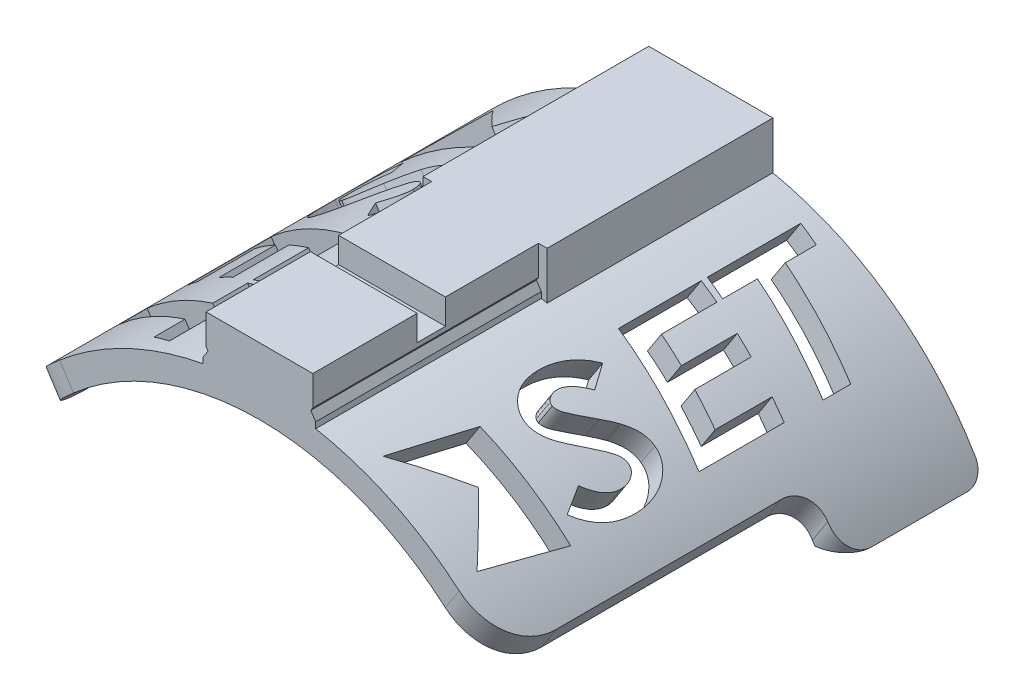
from build123d import *
from build123d.topology import SkipClean

# Parameters (mm, degrees)
BOSS_EXTRU_1_DEPTH           = 145
ENL_V_MAT_EXTRU_5_DEPTH      = 40
ESQUISSE23_W                 = 18.93
ESQUISSE23_H                 = 4.5
ENL_V_MAT_EXTRU_8_DEPTH      = 5
COQUE7_DEPTH                 = 102.5
COQUE7_START                 = 102.5
COQUE7_2_DEPTH               = 16.5
COQUE7_START_2               = 129
COQUE7_3_DEPTH               = 13.5
COQUE7_START_3               = 119
COQUE7_4_DEPTH               = 10
ENL_V_MAT_EXTRU_9_DEPTH      = 40
BOSS_EXTRU_7_DEPTH           = 2
ENL_V_MAT_EXTRU_6_DEPTH      = 10
R_P_TITION_CIRCULAIRE1_COUNT = 2
ENL_V_START                  = -65
ESQUISSE25_W                 = 97.112048686
ESQUISSE25_H                 = 37.05
ENL_V_MAT_EXTRU_10_DEPTH     = 65
ENL_V_MAT_EXTRU_12_DEPTH     = 167.08894215
BOSS_EXTRU_8_DEPTH           = 3
CONG_1_R                     = 3


# Read off the part's stored shape, not the designer's step: Coque7
with BuildPart() as part:
    # Esquisse1 → Boss.-Extru.1 (new body)
    with BuildSketch(Plane.XY):
        with BuildLine():
            Line((11, 61.8), (11, 53.378366404))
            ThreePointArc((11, 53.378366404), (33.039761646, 43.343098071), (48.556024343, 24.75))
            Line((48.556024343, 24.75), (43.444648692, 24.75))
            ThreePointArc((43.444648692, 24.75), (0, 50), (-43.444648692, 24.75))
            Line((-43.444648692, 24.75), (-48.556024343, 24.75))
            ThreePointArc((-48.556024343, 24.75), (-33.039761646, 43.343098071), (-11, 53.378366404))
            Line((-11, 53.378366404), (-11, 61.8))
            Line((-11, 61.8), (11, 61.8))
        make_face()
    extrude(amount=BOSS_EXTRU_1_DEPTH)

    # Esquisse8 → Enlèv. mat.-Extru.5 (cut)
    with BuildSketch(Plane.XY.offset(145)):
        Polygon((9.465, 61.8), (-9.465, 61.8), (-9.465, 56.52), (-9.095982677, 55.960780709), (-9.966432785, 54.642176671), (-9.966432785, 54.142176671), (-11, 54.142176671), (-11, 61.8), (-11, 71.016985955), (11, 71.016985955), (11, 54.142176671), (9.966432785, 54.142176671), (9.966432785, 54.642176671), (9.095982677, 55.960780709), (9.465, 56.52), align=None)
    extrude(amount=-ENL_V_MAT_EXTRU_5_DEPTH, mode=Mode.SUBTRACT)

    # Esquisse23 → Enlèv. mat.-Extru.8 (cut)
    with BuildSketch(Plane.XY.offset(126.5)):
        with Locations((0, 59.55)):
            Rectangle(ESQUISSE23_W, ESQUISSE23_H)
    extrude(amount=-ENL_V_MAT_EXTRU_8_DEPTH, mode=Mode.SUBTRACT)

    # Coque7 outline → Coque7 (cut)
    with BuildSketch(Plane.XY):
        with BuildLine():
            Line((-8.5, 59.3), (-8.5, 51.807335388))
            ThreePointArc((-8.5, 51.807335388), (0, 52.5), (8.5, 51.807335388))
            Line((8.5, 51.807335388), (8.5, 59.3))
            Line((8.5, 59.3), (-8.5, 59.3))
        make_face()
    extrude(amount=COQUE7_DEPTH, mode=Mode.SUBTRACT)

    # Coque7 2 outline → Coque7 2 (cut)
    with BuildSketch(Plane.XY.offset(COQUE7_START)):
        with BuildLine():
            Line((-6.100563013, 55.960519309), (-7.466432785, 53.891427261))
            Line((-7.466432785, 53.891427261), (-7.466432785, 51.96635817))
            ThreePointArc((-7.466432785, 51.96635817), (0, 52.5), (7.466432785, 51.96635817))
            Line((7.466432785, 51.96635817), (7.466432785, 53.891427261))
            Line((7.466432785, 53.891427261), (6.100563013, 55.960519309))
            Line((6.100563013, 55.960519309), (6.965, 57.270511575))
            Line((6.965, 57.270511575), (6.965, 59.3))
            Line((6.965, 59.3), (-6.965, 59.3))
            Line((-6.965, 59.3), (-6.965, 57.270511575))
            Line((-6.965, 57.270511575), (-6.100563013, 55.960519309))
        make_face()
    extrude(amount=COQUE7_2_DEPTH, mode=Mode.SUBTRACT)

    # Coque7 3 outline → Coque7 3 (cut)
    with BuildSketch(Plane.XY.offset(COQUE7_START_2)):
        with BuildLine():
            Line((-6.100563013, 55.960519309), (-7.466432785, 53.891427261))
            Line((-7.466432785, 53.891427261), (-7.466432785, 51.96635817))
            ThreePointArc((-7.466432785, 51.96635817), (0, 52.5), (7.466432785, 51.96635817))
            Line((7.466432785, 51.96635817), (7.466432785, 53.891427261))
            Line((7.466432785, 53.891427261), (6.100563013, 55.960519309))
            Line((6.100563013, 55.960519309), (6.965, 57.270511575))
            Line((6.965, 57.270511575), (6.965, 59.3))
            Line((6.965, 59.3), (-6.965, 59.3))
            Line((-6.965, 59.3), (-6.965, 57.270511575))
            Line((-6.965, 57.270511575), (-6.100563013, 55.960519309))
        make_face()
    extrude(amount=COQUE7_3_DEPTH, mode=Mode.SUBTRACT)

    # Coque7 4 outline → Coque7 4 (cut)
    with BuildSketch(Plane.XY.offset(COQUE7_START_3)):
        with BuildLine():
            Line((6.866656647, 54.8), (-6.866656647, 54.8))
            Line((-6.866656647, 54.8), (-7.466432785, 53.891427261))
            Line((-7.466432785, 53.891427261), (-7.466432785, 51.96635817))
            ThreePointArc((-7.466432785, 51.96635817), (0, 52.5), (7.466432785, 51.96635817))
            Line((7.466432785, 51.96635817), (7.466432785, 53.891427261))
            Line((7.466432785, 53.891427261), (6.866656647, 54.8))
        make_face()
    extrude(amount=COQUE7_4_DEPTH, mode=Mode.SUBTRACT)

    # Esquisse24 → Enlèv. mat.-Extru.9 (cut)
    with BuildSketch(Plane.XY.offset(105)):
        with BuildLine():
            Line((9.966432785, 54.142176671), (11, 54.142176671))
            Line((11, 54.142176671), (11, 53.378366404))
            ThreePointArc((11, 53.378366404), (10.483705827, 53.48216443), (9.966432785, 53.5809688))
            Line((9.966432785, 53.5809688), (9.966432785, 54.142176671))
        make_face()
        with BuildLine():
            Line((-11, 54.142176671), (-9.966432785, 54.142176671))
            Line((-9.966432785, 54.142176671), (-9.966432785, 53.5809688))
            ThreePointArc((-9.966432785, 53.5809688), (-10.483705827, 53.48216443), (-11, 53.378366404))
            Line((-11, 53.378366404), (-11, 54.142176671))
        make_face()
    extrude(amount=ENL_V_MAT_EXTRU_9_DEPTH, mode=Mode.SUBTRACT)

    # Esquisse16 → Boss.-Extru.7 (add)
    with BuildSketch(Plane(origin=(0, 0, 0), x_dir=(-1, 0, 0), z_dir=(0, 0, -1))):
        with BuildLine():
            Line((11, 61.8), (-11, 61.8))
            Line((-11, 61.8), (-11, 53.378366404))
            ThreePointArc((-11, 53.378366404), (-33.039761646, 43.343098071), (-48.556024343, 24.75))
            Line((-48.556024343, 24.75), (-43.444648692, 24.75))
            ThreePointArc((-43.444648692, 24.75), (0, 50), (43.444648692, 24.75))
            Line((43.444648692, 24.75), (48.556024343, 24.75))
            ThreePointArc((48.556024343, 24.75), (33.039761646, 43.343098071), (11, 53.378366404))
            Line((11, 53.378366404), (11, 61.8))
        make_face()
    extrude(amount=-BOSS_EXTRU_7_DEPTH)

    # Esquisse20 → Enlèv. mat.-Extru.6 (cut)
    with BuildSketch(Plane(origin=(29.682827408, 45.707545953, 0), x_dir=(-0.8386705679454272, 0.5446390350150224, 0), z_dir=(0.5446390350150224, 0.8386705679454272, 0))):
        Polygon((9.855900057, 126.817740377), (-9.219044866, 126.817740377), (-6.169102617, 141.093120116), (3.031167376, 133.286236941), (12.905842307, 141.093120116), align=None)
        with BuildLine():
            Line((9.00498024, 105.886575416), (6.43970914, 109.656039892))
            add(Edge.make_bspline(
                [(6.43970914, 109.656039892), (6.638551673, 109.845899276), (7.021246309, 110.211304839), (7.536051252, 110.7772966), (7.977281746, 111.330108329), (8.331845241, 111.880913694), (8.610361527, 112.420213128), (8.813740282, 112.949400132), (8.939914155, 113.470448431), (8.955145191, 113.816366313), (8.962579065, 113.985199882)],
                knots=[0, 0, 0, 0, 1.28138621, 2.466170703, 3.564226601, 4.574985265, 5.515057864, 6.388849122, 7.213638939, 8, 8, 8, 8], degree=3))
            add(Edge.make_bspline(
                [(8.962579065, 113.985199882), (8.957032032, 114.143918987), (8.946347066, 114.449651484), (8.860220843, 114.888596443), (8.718451691, 115.287538697), (8.513331335, 115.632629155), (8.278528567, 115.922180046), (8.009575947, 116.133148299), (7.714826291, 116.267503018), (7.506738439, 116.283692053), (7.402215817, 116.291823813)],
                knots=[0, 0, 0, 0, 1.239941831, 2.388436538, 3.482545333, 4.532407983, 5.512815959, 6.379186426, 7.185864615, 8, 8, 8, 8], degree=3))
            add(Edge.make_bspline(
                [(7.402215817, 116.291823813), (7.299709013, 116.283198178), (7.082389511, 116.264911404), (6.751417799, 116.147556803), (6.412791907, 115.948382795), (6.110762245, 115.730278333), (5.844515275, 115.477954004), (5.575197102, 115.216970287), (5.261886633, 114.870204676), (4.885675458, 114.453391374), (4.455062769, 113.959364121), (3.972674808, 113.383693637), (3.42913994, 112.737945283), (3.053986041, 112.277008461), (2.856809834, 112.034745822)],
                knots=[0, 0, 0, 0, 0.580699583, 1.231111871, 1.965688795, 2.801225581, 3.33365008, 4.041043863, 4.924495772, 5.97858417, 7.220802023, 8.634887725, 10.231338997, 12, 12, 12, 12], degree=3))
            add(Edge.make_bspline(
                [(2.856809834, 112.034745822), (2.750917628, 111.906037758), (2.546838003, 111.657986515), (2.252453561, 111.30377996), (1.98136357, 110.985482042), (1.733193951, 110.703489296), (1.509727564, 110.454856161), (1.312106006, 110.238407016), (1.137634875, 110.059346876), (1.028142451, 109.954020365), (0.978437772, 109.906206826)],
                knots=[0, 0, 0, 0, 1.408298228, 2.714127721, 3.891595392, 4.940901426, 5.888051599, 6.716310398, 7.417262163, 8, 8, 8, 8], degree=3))
            add(Edge.make_bspline(
                [(0.978437772, 109.906206826), (0.770294212, 109.714012223), (0.371383588, 109.345668044), (-0.240593748, 108.860764165), (-0.83023469, 108.458605588), (-1.403274733, 108.13758951), (-1.970557226, 107.901567426), (-2.537592082, 107.734202238), (-3.109289881, 107.627949243), (-3.494443798, 107.614661261), (-3.685691501, 107.60806313)],
                knots=[0, 0, 0, 0, 1.274429781, 2.442466046, 3.509623425, 4.483132402, 5.392566679, 6.267918392, 7.139937007, 8, 8, 8, 8], degree=3))
            add(Edge.make_bspline(
                [(-3.685691501, 107.60806313), (-3.896838533, 107.613559428), (-4.313656059, 107.624409468), (-4.923605208, 107.741515455), (-5.508906969, 107.916800712), (-6.065822417, 108.172552044), (-6.598297227, 108.494806957), (-7.101203144, 108.896120925), (-7.582138552, 109.362934422), (-8.026466838, 109.901831677), (-8.438320415, 110.489843579), (-8.789343859, 111.131804421), (-9.091455521, 111.810673826), (-9.337010888, 112.53032156), (-9.52877478, 113.288970868), (-9.661012125, 114.088981328), (-9.750319371, 114.928724469), (-9.757909394, 115.502920252), (-9.761779909, 115.795730063)],
                knots=[0, 0, 0, 0, 0.892117206, 1.761095492, 2.617811278, 3.47135016, 4.345986664, 5.244253171, 6.187096921, 7.17612425, 8.194427065, 9.219377751, 10.265932693, 11.334190361, 12.431889946, 13.572061692, 14.761878478, 16, 16, 16, 16], degree=3))
            add(Edge.make_bspline(
                [(-9.761779909, 115.795730063), (-9.758186733, 116.020529511), (-9.751060542, 116.466364606), (-9.704355992, 117.127422693), (-9.624397022, 117.77298488), (-9.509062172, 118.401078416), (-9.364263081, 119.013717074), (-9.191839526, 119.611975741), (-8.98401134, 120.194180267), (-8.739691385, 120.758809933), (-8.471273682, 121.310526574), (-8.162758463, 121.842990526), (-7.822543971, 122.359680465), (-7.455778645, 122.864139665), (-7.053779096, 123.350056499), (-6.620130254, 123.820687565), (-6.156803354, 124.27903718), (-5.824447351, 124.56478796), (-5.657346149, 124.708457093)],
                knots=[0, 0, 0, 0, 1.062524733, 2.107259698, 3.130587603, 4.135609675, 5.124042723, 6.104997664, 7.076994759, 8.04365117, 9.011645514, 9.975319517, 10.94993019, 11.934699263, 12.921776869, 13.928839507, 14.958666592, 16, 16, 16, 16], degree=3))
            Line((-5.657346149, 124.708457093), (-3.193837869, 120.765147798))
            add(Edge.make_bspline(
                [(-3.193837869, 120.765147798), (-3.434398733, 120.568048634), (-3.899218383, 120.187207117), (-4.523814088, 119.575362728), (-5.046765029, 118.945567275), (-5.481952972, 118.308161747), (-5.816488077, 117.653908888), (-6.055688959, 116.987380469), (-6.208302897, 116.307195204), (-6.225439615, 115.847390656), (-6.234002131, 115.617645127)],
                knots=[0, 0, 0, 0, 1.204701232, 2.327763527, 3.381677023, 4.372032335, 5.312556578, 6.220284422, 7.110748909, 8, 8, 8, 8], degree=3))
            add(Edge.make_bspline(
                [(-6.234002131, 115.617645127), (-6.226656435, 115.404895285), (-6.21245791, 114.993670278), (-6.080462721, 114.404631888), (-5.873365498, 113.865432512), (-5.582817057, 113.391754773), (-5.237304779, 112.993542118), (-4.839147972, 112.707302665), (-4.404859725, 112.521466026), (-4.098794239, 112.502333646), (-3.94433867, 112.492678514)],
                knots=[0, 0, 0, 0, 1.189963192, 2.300084526, 3.362829334, 4.410851013, 5.397532245, 6.293770177, 7.138953232, 8, 8, 8, 8], degree=3))
            add(Edge.make_bspline(
                [(-3.94433867, 112.492678514), (-3.819277225, 112.499242745), (-3.563377452, 112.512674425), (-3.181473728, 112.625414008), (-2.800866575, 112.810088278), (-2.474922908, 113.015531879), (-2.19225705, 113.243996064), (-1.936624297, 113.488319598), (-1.634257822, 113.794071231), (-1.29478153, 114.168277948), (-0.904668168, 114.601353711), (-0.480379971, 115.106670312), (-0.009088498, 115.674338079), (0.316046868, 116.076595179), (0.48658414, 116.287583696)],
                knots=[0, 0, 0, 0, 0.749102756, 1.532808332, 2.367106529, 3.2819383, 3.836685124, 4.544448167, 5.401689594, 6.415636989, 7.57446249, 8.897670014, 10.372791922, 12, 12, 12, 12], degree=3))
            add(Edge.make_bspline(
                [(0.48658414, 116.287583696), (0.668058132, 116.513005252), (1.017487942, 116.947056492), (1.533186572, 117.559633024), (2.015253874, 118.111169204), (2.452636118, 118.610380653), (2.863341544, 119.041315913), (3.239188086, 119.411862874), (3.573648723, 119.728947938), (3.79699024, 119.907124352), (3.899878745, 119.989206292)],
                knots=[0, 0, 0, 0, 1.376923742, 2.651279094, 3.809630543, 4.862358715, 5.80895329, 6.641136661, 7.374001669, 8, 8, 8, 8], degree=3))
            add(Edge.make_bspline(
                [(3.899878745, 119.989206292), (4.028722038, 120.084200502), (4.27975443, 120.269282885), (4.667683411, 120.512099553), (5.054052157, 120.717552268), (5.440908822, 120.881690536), (5.823781379, 121.016489529), (6.205854379, 121.108976187), (6.586283649, 121.167532741), (6.839486563, 121.173479842), (6.965483713, 121.176439198)],
                knots=[0, 0, 0, 0, 1.147508812, 2.235753787, 3.278449164, 4.281838234, 5.246555568, 6.185536712, 7.097098848, 8, 8, 8, 8], degree=3))
            add(Edge.make_bspline(
                [(6.965483713, 121.176439198), (7.128276099, 121.171424089), (7.452826398, 121.16142574), (7.93304323, 121.08477979), (8.397658174, 120.949789565), (8.852546781, 120.771805427), (9.291543291, 120.537039616), (9.720376376, 120.253541447), (10.136520613, 119.919954934), (10.392488173, 119.662490581), (10.522942313, 119.5312736)],
                knots=[0, 0, 0, 0, 0.968622446, 1.931089728, 2.884286853, 3.843329825, 4.832908039, 5.840728371, 6.89952491, 8, 8, 8, 8], degree=3))
            add(Edge.make_bspline(
                [(10.522942313, 119.5312736), (10.681473386, 119.355339512), (10.998167216, 119.003880084), (11.393714983, 118.411422026), (11.737670787, 117.781635671), (12.011816729, 117.101975716), (12.229199315, 116.37978765), (12.379031207, 115.611300881), (12.475698688, 114.798951954), (12.48539004, 114.241309813), (12.490356843, 113.955519059)],
                knots=[0, 0, 0, 0, 0.936434341, 1.870693066, 2.812029103, 3.773145412, 4.766222467, 5.793315899, 6.869077735, 8, 8, 8, 8], degree=3))
            add(Edge.make_bspline(
                [(12.490356843, 113.955519059), (12.479605419, 113.562087128), (12.458435316, 112.787399596), (12.29566908, 111.648193689), (12.017897872, 110.5612132), (11.640980005, 109.51939637), (11.143443526, 108.532393224), (10.542914324, 107.590843106), (9.833155258, 106.696793072), (9.283822576, 106.159371599), (9.00498024, 105.886575416)],
                knots=[0, 0, 0, 0, 1.042459475, 2.05265586, 3.041997772, 4.011346866, 4.982936898, 5.964883687, 6.966971009, 8, 8, 8, 8], degree=3))
        make_face()
        Polygon((11.9476218, 100.30234064), (11.9476218, 85.627293899), (8.419844022, 86.186989412), (8.419844022, 96.002861474), (3.535228638, 96.876325683), (3.535228638, 86.9586908), (0.00745086, 87.518386313), (0.00745086, 97.508103194), (-5.691267089, 98.521491281), (-5.691267089, 88.421531345), (-9.219044866, 88.981226858), (-9.219044866, 104.080285352), align=None)
        Polygon((11.9476218, 84.541823813), (11.9476218, 67.98840501), (8.419844022, 68.573541228), (8.419844022, 74.068733536), (-9.219044866, 77.172499561), (-9.219044866, 82.099516121), (8.419844022, 78.995750095), (8.419844022, 85.165121089), align=None)
    enl_v_mat_extru_6 = extrude(amount=-ENL_V_MAT_EXTRU_6_DEPTH, mode=Mode.SUBTRACT)

    # Répétition circulaire1: Enlèv. mat.-Extru.6 ×2 about axis
    r_p_tition_circulaire1_axis = Axis((0, 22.8975, 105), (0, 1, 0))
    for i in range(1, R_P_TITION_CIRCULAIRE1_COUNT):
        add(enl_v_mat_extru_6.rotate(r_p_tition_circulaire1_axis, i * 360 / R_P_TITION_CIRCULAIRE1_COUNT), mode=Mode.SUBTRACT)

    # Esquisse25 → Enlèv. mat.-Extru.10 (cut)
    with BuildSketch(Plane.XY.offset(65).offset(ENL_V_START)):
        with Locations((0, 43.275)):
            Rectangle(ESQUISSE25_W, ESQUISSE25_H)
    extrude(amount=ENL_V_MAT_EXTRU_10_DEPTH, mode=Mode.SUBTRACT)

    # Esquisse28 → Enlèv. mat.-Extru.12 (cut, through all)
    with BuildSketch(Plane(origin=(29.682827408, 45.707545953, 0), x_dir=(-0.8386705679454272, 0.5446390350150224, 0), z_dir=(0.5446390350150224, 0.8386705679454272, 0))):
        with BuildLine():
            Line((-7.142692396, 145), (5.791957623, 145))
            Line((5.791957623, 145), (5.791957623, 155))
            Line((5.791957623, 155), (-34.208042377, 155))
            Line((-34.208042377, 155), (-34.208042377, 65))
            Line((-34.208042377, 65), (-27.242692396, 65))
            Line((-27.242692396, 65), (-27.242692396, 85))
            ThreePointArc((-27.242692396, 85), (-25.778226302, 88.535533906), (-22.242692396, 90))
            Line((-22.242692396, 90), (-22.142692396, 90))
            ThreePointArc((-22.142692396, 90), (-18.60715849, 91.464466094), (-17.142692396, 95))
            Line((-17.142692396, 95), (-17.142692396, 135))
            ThreePointArc((-17.142692396, 135), (-14.213760208, 142.071067812), (-7.142692396, 145))
        make_face()
    enl_v_mat_extru_12 = extrude(amount=-ENL_V_MAT_EXTRU_12_DEPTH, mode=Mode.SUBTRACT)

    # Symétrie1: Enlèv. mat.-Extru.12 across plane
    add(enl_v_mat_extru_12.mirror(Plane(origin=(0, 0, 0), x_dir=(0, 0, 1), z_dir=(1, 0, 0))), mode=Mode.SUBTRACT)

    # Esquisse29 → Boss.-Extru.8 (add)
    with SkipClean():  # the faces are left unmerged after this step: merging them gives an invalid solid
        with BuildSketch(Plane(origin=(0, 0, 65), x_dir=(-1, 0, 0), z_dir=(0, 0, -1))):
            with BuildLine():
                Line((-11, 61.8), (-11, 48.774993593))
                ThreePointArc((-11, 48.774993593), (0, 50), (11, 48.774993593))
                Line((11, 48.774993593), (11, 61.8))
                Line((11, 61.8), (-11, 61.8))
            make_face()
        extrude(amount=-BOSS_EXTRU_8_DEPTH)

    # Congé1
    cong_1_edges = [part.edges().sort_by_distance(p)[0] for p in [
        (46.000336518, 24.75, 65),
        (-46.000336518, 24.75, 65),
    ]]
    fillet(cong_1_edges, radius=CONG_1_R)


solid = part.part
